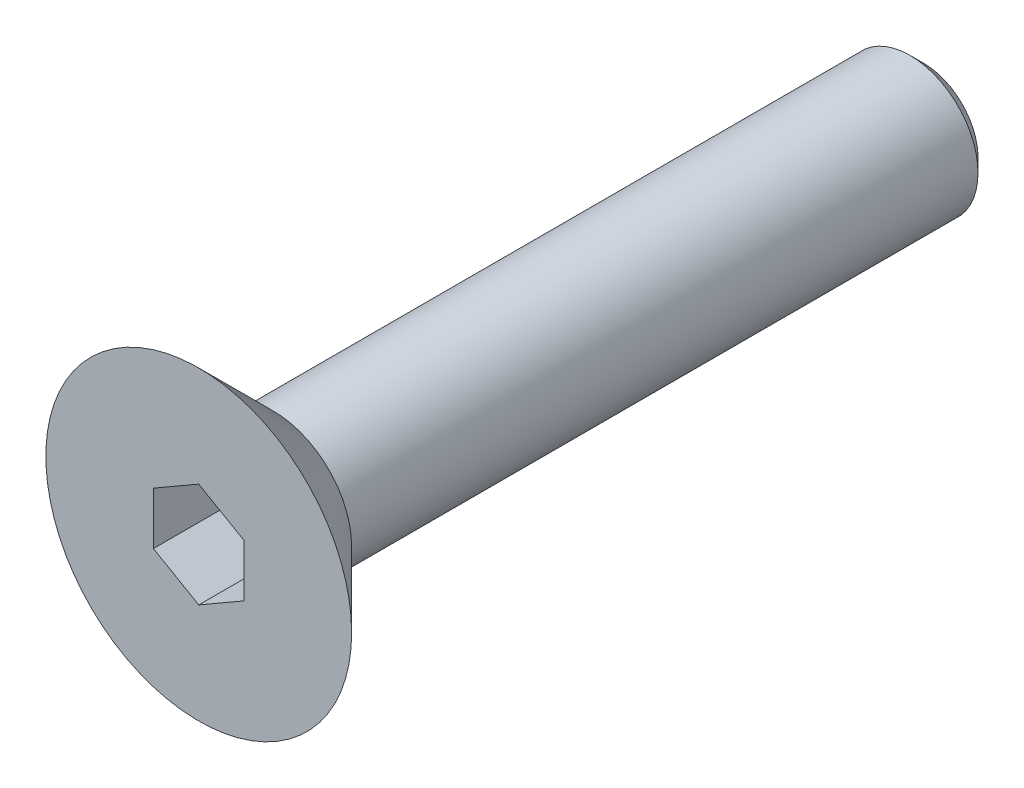
from build123d import *

# Parameters (mm, degrees)
SKETCH1_R           = 3.375
BOSS_EXTRUDE1_DEPTH = 1.65
SKETCH2_R           = 1.5
BOSS_EXTRUDE2_DEPTH = 14.35
CHAMFER1_SIZE       = 0.3
CUT_EXTRUDE1_DEPTH  = 2
CHAMFER2_SIZE       = 1.65


with BuildPart() as part:
    # Sketch1 → Boss-Extrude1 (new body)
    with BuildSketch(Plane.XY):
        Circle(SKETCH1_R)
    extrude(amount=BOSS_EXTRUDE1_DEPTH)

    # Sketch2 → Boss-Extrude2 (add)
    with BuildSketch(Plane(origin=(0, 0, 0), x_dir=(-1, 0, 0), z_dir=(0, 0, -1))):
        with Locations(Location((0, 0, 0), (0, 0, 180))):
            Circle(SKETCH2_R)
    extrude(amount=BOSS_EXTRUDE2_DEPTH)

    # Chamfer1
    chamfer1_edges = [part.edges().sort_by_distance(p)[0] for p in [
        (-1.5, 0, -14.35),
    ]]
    chamfer(chamfer1_edges, length=CHAMFER1_SIZE)

    # Sketch3 → Cut-Extrude1 (cut)
    with BuildSketch(Plane.XY.offset(1.65)):
        Polygon((0, 1.154700538), (-1, 0.577350269), (-1, -0.577350269), (0, -1.154700538), (1, -0.577350269), (1, 0.577350269), align=None)
    extrude(amount=-CUT_EXTRUDE1_DEPTH, mode=Mode.SUBTRACT)

    # Chamfer2
    chamfer2_edges = [part.edges().sort_by_distance(p)[0] for p in [
        (-3.375, 0, 0),
    ]]
    chamfer(chamfer2_edges, length=CHAMFER2_SIZE - 0.0001)  # a hair under: the kernel refuses the full size


solid = part.part
